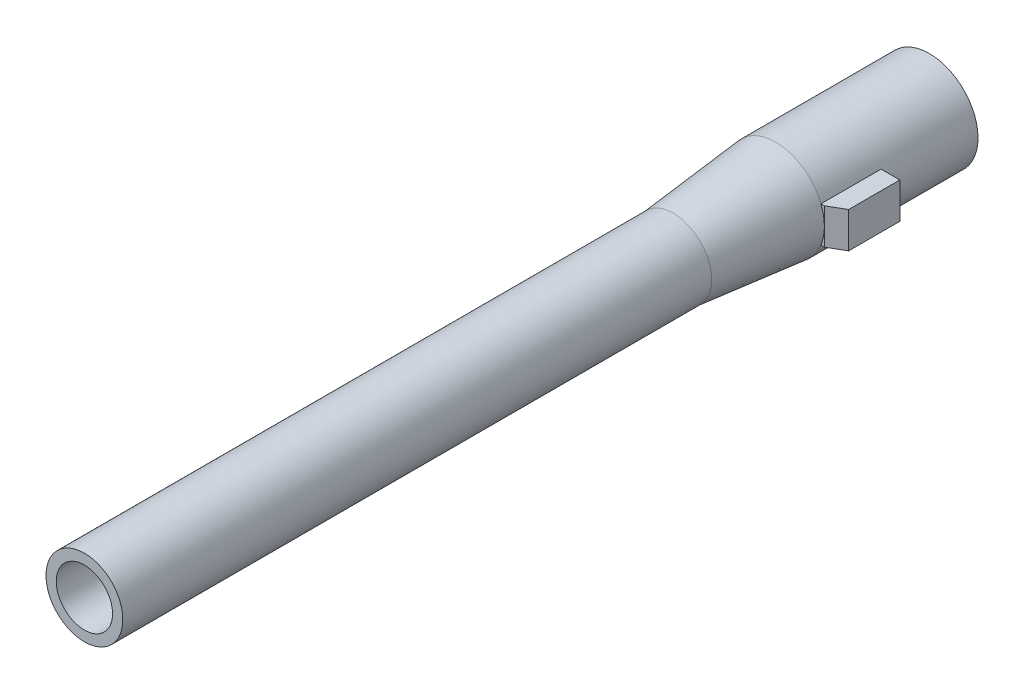
from build123d import *

# Parameters (mm, degrees)
SKETCH1_R                = 9.5
SKETCH1_R_2              = 7.6
BOSS_EXTRUDE1_DEPTH      = 30
BOSS_EXTRUDE4_DEPTH      = 3.5
BOSS_EXTRUDE4_DEPTH_BACK = 3.5


with BuildPart() as part:
    # Sketch1 → Boss-Extrude1 (new body)
    with BuildSketch(Plane.XY):
        Circle(SKETCH1_R)
        Circle(SKETCH1_R_2, mode=Mode.SUBTRACT)
    extrude(amount=BOSS_EXTRUDE1_DEPTH)

    # Sketch4 → Revolve1 (revolve)
    with BuildSketch(Plane(origin=(0, 0, 0), x_dir=(0, 0, -1), z_dir=(1, 0, 0))):
        Polygon((-165, 5.5), (-142.80777, 5), (-30, 5.75), (-30, 9.5), (-50, 7.5), (-142.80777, 7.5), (-165, 7.5), align=None)
    revolve(axis=Axis((0, 0, 30), (0, 0, 1)))

    # Sketch7 → Boss-Extrude4 (add, two sides: drawn at the far end of the back side and taken through both)
    with BuildSketch(Plane(origin=(0, 0, 0), x_dir=(1, 0, 0), z_dir=(0, 1, 0)).offset(-BOSS_EXTRUDE4_DEPTH_BACK)):
        Polygon((9.5, -18.267949192), (7.6, -18.267949192), (7.6, -30), (9.5, -30), (12.5, -28.267949192), (12.5, -18.267949192), align=None)
    extrude(amount=BOSS_EXTRUDE4_DEPTH + BOSS_EXTRUDE4_DEPTH_BACK)

    # Sketch8 → Cut-Revolve1 (revolve, cut)
    with BuildSketch(Plane(origin=(0, 0, 0), x_dir=(0, 0, -1), z_dir=(1, 0, 0))):
        Polygon((-30, 7.6), (-31.862382006, 5.737617994), (-30, 5.75), align=None)
    revolve(axis=Axis((0, 0, 30), (0, 0, 1)), mode=Mode.SUBTRACT)


solid = part.part
